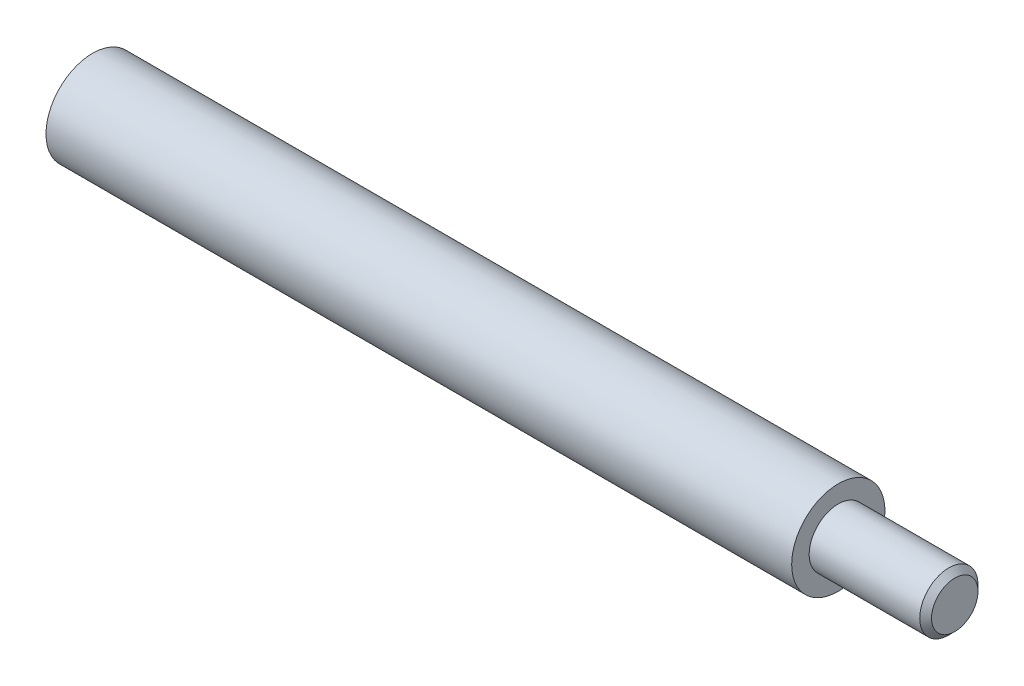
from build123d import *

# Parameters (mm, degrees)
M3_GEWINDEBOHRUNG1_D     = 2.5
M3_GEWINDEBOHRUNG1_DEPTH = 6.5
M3_GEWINDEBOHRUNG1_TIP   = 0.751075774
FASE1_SIZE               = 0.2
SKETCH2_R                = 1.25
CUT_EXTRUDE1_DEPTH       = 3


# Read off the part's stored shape, not the designer's step: M2.5 Machine Threads Stud1
with BuildPart() as part:
    # Skizze1 → Rotation1 (revolve)
    with BuildSketch(Plane.XY, mode=Mode.PRIVATE) as rotation1_sk:
        Polygon((19, 0), (-16, 0), (-16, 2), (16, 2), (16, 1.25), (19, 1.25), align=None)
    revolve(rotation1_sk.sketch.rotate(Axis((0, 0, 0), (1, 0, 0)), 90), axis=Axis((0, 0, 0), (1, 0, 0)))

    # M3 Gewindebohrung1
    with Locations(Plane.ZY.offset(16)):
        with Locations((0, 0)):
            Hole(M3_GEWINDEBOHRUNG1_D / 2, depth=M3_GEWINDEBOHRUNG1_DEPTH)
            with Locations((0, 0, -(M3_GEWINDEBOHRUNG1_DEPTH + M3_GEWINDEBOHRUNG1_TIP / 2))):  # 118° drill point
                Cone(0, M3_GEWINDEBOHRUNG1_D / 2, M3_GEWINDEBOHRUNG1_TIP, mode=Mode.SUBTRACT)

    # Fase1
    fase1_edges = [part.edges().sort_by_distance(p)[0] for p in [
        (19, 0, -1.25),
    ]]
    chamfer(fase1_edges, length=FASE1_SIZE)

    # Sketch2 → Cut-Extrude1 (cut)
    with BuildSketch(Plane(origin=(19, 0, 0), x_dir=(0, 0, -1), z_dir=(1, 0, 0))):
        with Locations(Location((0, 0, 0), (0, 0, 180))):
            Circle(SKETCH2_R)
    extrude(amount=-CUT_EXTRUDE1_DEPTH, mode=Mode.SUBTRACT)

    # M2.5 Machine Threads Stud1 outline → M2.5 Machine Threads Stud1 (revolve)
    with BuildSketch(Plane.YX):
        Polygon((0.9965, 21), (0, 21), (0, 16), (1.25, 16), (1.25, 20.7465), align=None)
    revolve(axis=Axis((0, 0, 0), (1, 0, 0)))


solid = part.part
